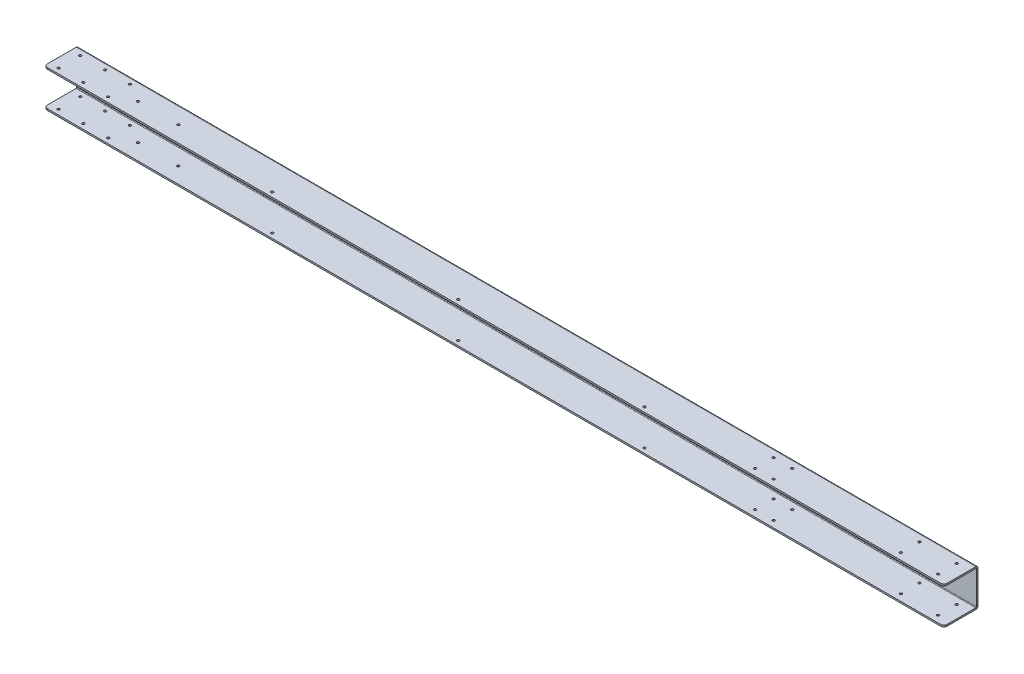
from build123d import *

# Parameters (mm, degrees)
SKETCH2_W                      = 1841.5
SKETCH2_H                      = 69.6722
BASE_FLANGE1_DEPTH             = 3.2639
EDGE_FLANGE1_STRIP_W           = 15.5956
EDGE_FLANGE1_STRIP_H           = 3.2639
EDGE_FLANGE1_STRIP_CUT_DEPTH   = 1841.5
EDGE_FLANGE1_STRIP_2_W         = 15.5956
EDGE_FLANGE1_STRIP_2_H         = 3.2639
EDGE_FLANGE1_STRIP_CUT_2_DEPTH = 1841.5
EDGE_FLANGE1_DEPTH             = 1841.5
EDGE_FLANGE1_BEND_DEPTH        = 1841.5
F_10_0_1935_DIAMETER_HOLE1_D   = 4.9149
F_10_0_1935_DIAMETER_HOLE3_D   = 4.9149
F_10_0_1935_DIAMETER_HOLE4_D   = 4.9149
F_10_0_2_DIAMETER_HOLE1_D      = 5.08
F_10_0_1935_DIAMETER_HOLE6_D   = 4.9149
LPATTERN2_COUNT                = 3
LPATTERN2_PITCH                = 381
FILLET2_R                      = 6.35


# Sheet-metal steps are written as plain solids
with BuildPart() as part:
    # Sketch2 → Base-Flange1 (new body)
    with BuildSketch(Plane.XY):
        Rectangle(SKETCH2_W, SKETCH2_H)
    extrude(amount=-BASE_FLANGE1_DEPTH)

    # Edge-Flange1 strip (across the edge) → Edge-Flange1 strip cut (cut)
    with BuildSketch(Plane(origin=(920.75, 34.8361, 0), x_dir=(0, -1, 0), z_dir=(-1, 0, 0))):
        with Locations((-6.5278, -1.63195)):
            Rectangle(EDGE_FLANGE1_STRIP_W, EDGE_FLANGE1_STRIP_H)
    extrude(amount=EDGE_FLANGE1_STRIP_CUT_DEPTH, mode=Mode.SUBTRACT)

    # Edge-Flange1 strip 2 (across the edge) → Edge-Flange1 strip cut 2 (cut)
    with BuildSketch(Plane(origin=(-920.75, -34.8361, 0), x_dir=(0, 1, 0), z_dir=(1, 0, 0))):
        with Locations((-6.5278, -1.63195)):
            Rectangle(EDGE_FLANGE1_STRIP_2_W, EDGE_FLANGE1_STRIP_2_H)
    extrude(amount=EDGE_FLANGE1_STRIP_CUT_2_DEPTH, mode=Mode.SUBTRACT)

    # Edge-Flange1 section (across the edge) → Edge-Flange1 (add)
    with BuildSketch(Plane(origin=(920.75, 34.8361, 0), x_dir=(0, -1, 0), z_dir=(-1, 0, 0))):
        with BuildLine():
            Line((-3.2639, 1.27), (-3.2639, 66.5861))
            Line((-3.2639, 66.5861), (0, 66.5861))
            Line((0, 66.5861), (0, 1.27))
            ThreePointArc((0, 1.27), (0.371974388, 0.371974388), (1.27, 0))
            Line((1.27, 0), (1.27, -3.2639))
            ThreePointArc((1.27, -3.2639), (-1.935951435, -1.935951435), (-3.2639, 1.27))
        make_face()
    extrude(amount=EDGE_FLANGE1_DEPTH)

    # Edge-Flange1 section 2 (across the edge) → Edge-Flange1 bend (add)
    with BuildSketch(Plane(origin=(-920.75, -34.8361, 0), x_dir=(0, 1, 0), z_dir=(1, 0, 0))):
        with BuildLine():
            Line((-3.2639, 1.27), (-3.2639, 66.5861))
            Line((-3.2639, 66.5861), (0, 66.5861))
            Line((0, 66.5861), (0, 1.27))
            ThreePointArc((0, 1.27), (0.371974388, 0.371974388), (1.27, 0))
            Line((1.27, 0), (1.27, -3.2639))
            ThreePointArc((1.27, -3.2639), (-1.935951435, -1.935951435), (-3.2639, 1.27))
        make_face()
    extrude(amount=EDGE_FLANGE1_BEND_DEPTH)

    # #10 (0.1935) Diameter Hole1 (through all)
    with Locations(Plane(origin=(0, 38.1, 34.8361), x_dir=(-1, 0, 0), z_dir=(0, 1, 0))):
        with Locations((800.1, -23.13305), (800.1, 21.31695), (850.9, 21.31695), (850.9, -23.13305), (901.7, 21.31695), (901.7, -23.13305)):
            Hole(F_10_0_1935_DIAMETER_HOLE1_D / 2)

    # #10 (0.1935) Diameter Hole3 (through all)
    with Locations(Plane(origin=(0, 38.1, 0), x_dir=(1, 0, 0), z_dir=(0, 1, 0))):
        with Locations((819.15, -14.87805), (819.15, -52.97805), (895.35, -14.87805), (895.35, -52.97805)):
            Hole(F_10_0_1935_DIAMETER_HOLE3_D / 2)

    # #10 (0.1935) Diameter Hole4 (through all)
    with Locations(Plane(origin=(0, 38.1, 0), x_dir=(1, 0, 0), z_dir=(0, 1, 0))):
        with Locations((520.7, -14.87805), (558.8, -14.87805), (558.8, -52.97805), (520.7, -52.97805)):
            Hole(F_10_0_1935_DIAMETER_HOLE4_D / 2)

    # #10 (0.2) Diameter Hole1 (through all)
    with Locations(Plane(origin=(0, 38.1, 0), x_dir=(1, 0, 0), z_dir=(0, 1, 0))):
        with Locations((-761.32055, -33.92805), (-678.77055, -33.92805)):
            Hole(F_10_0_2_DIAMETER_HOLE1_D / 2)

    # #10 (0.1935) Diameter Hole6 (through all)
    with Locations(Plane(origin=(0, -38.1, 0), x_dir=(-1, 0, 0), z_dir=(0, -1, 0))):
        with Locations((463.55, -57.0611)):
            f_10_0_1935_diameter_hole6 = Hole(F_10_0_1935_DIAMETER_HOLE6_D / 2)

    # LPattern2: #10 (0.1935) Diameter Hole6 ×3
    with Locations(*[(i * LPATTERN2_PITCH, 0, 0) for i in range(1, LPATTERN2_COUNT)]):
        add(f_10_0_1935_diameter_hole6, mode=Mode.SUBTRACT)

    # Fillet2
    fillet2_edges = [part.edges().sort_by_distance(p)[0] for p in [
        (920.75, 36.46805, 66.5861),
        (-920.75, 36.46805, 66.5861),
        (-920.75, -36.46805, 66.5861),
        (920.75, -36.46805, 66.5861),
    ]]
    fillet(fillet2_edges, radius=FILLET2_R)


solid = part.part
